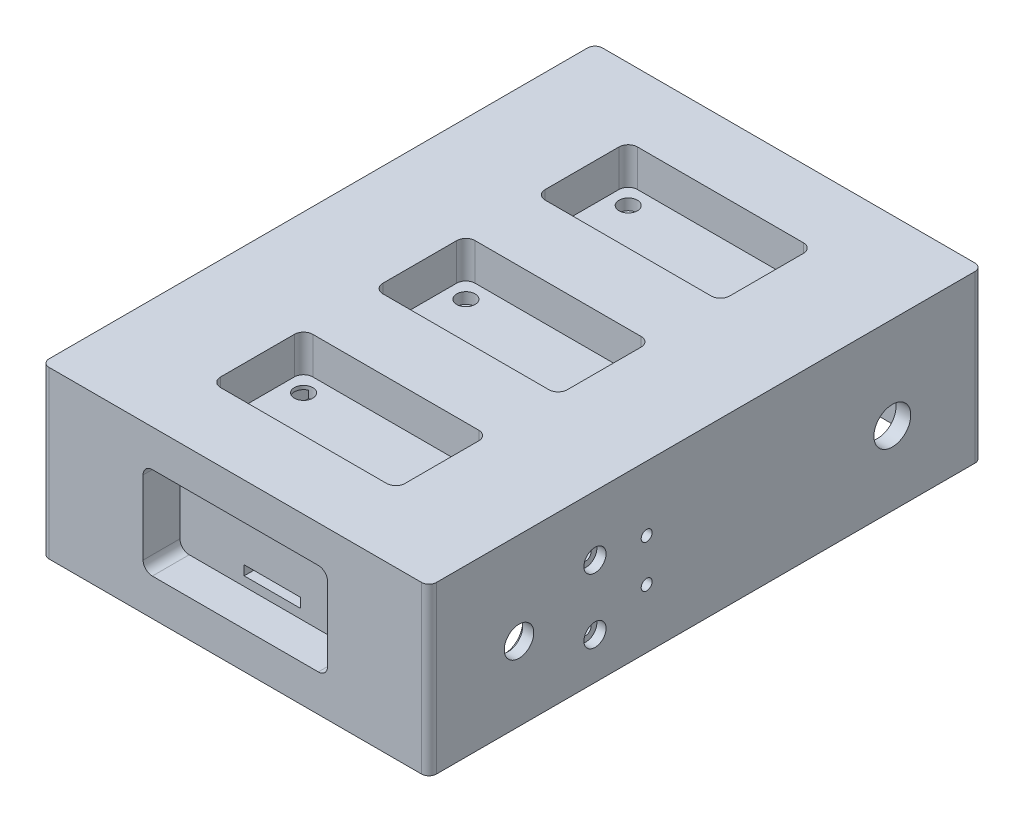
from build123d import *

# Parameters (mm, degrees)
SKETCH_1_W           = 105
SKETCH_1_H           = 150
EXTRUDE_1_DEPTH      = 45
CUT_EXTRUDE_1_DEPTH  = 10
CUT_EXTRUDE_2_DEPTH  = 10
SHELL_1_T            = -4
SKETCH_5_R           = 1.45
SKETCH_5_R_2         = 4
SKETCH_5_R_3         = 5
CUT_EXTRUDE_3_DEPTH  = 15
SKETCH_6_R           = 3
CUT_EXTRUDE_4_DEPTH  = 2.5
CUT_EXTRUDE_START    = -3
SKETCH_10_W          = 5
SKETCH_10_H          = 36.5
CUT_EXTRUDE_15_DEPTH = 100.655315425
SKETCH_11_R          = 5
CUT_EXTRUDE_16_DEPTH = 1
SKETCH_12_R          = 1.45
CUT_EXTRUDE_17_DEPTH = 14
SKETCH_13_R          = 1.45
CUT_EXTRUDE_18_DEPTH = 10
SKETCH_14_R          = 1.45
CUT_EXTRUDE_19_DEPTH = 3
SKETCH_15_R          = 2.5
SKETCH_15_W          = 15.2
SKETCH_15_H          = 2.6
CUT_EXTRUDE_20_DEPTH = 3
SKETCH_16_W          = 14
SKETCH_16_H          = 1.8
CUT_EXTRUDE_21_DEPTH = 3
SKETCH_17_R          = 2.5
SKETCH_17_W          = 15.2
SKETCH_17_H          = 2.6
CUT_EXTRUDE_22_DEPTH = 3
SKETCH_18_W          = 14
SKETCH_18_H          = 1.8
CUT_EXTRUDE_23_DEPTH = 3
SKETCH_19_R          = 2.5
SKETCH_19_W          = 15.2
SKETCH_19_H          = 2.6
CUT_EXTRUDE_24_DEPTH = 3
SKETCH_20_W          = 14
SKETCH_20_H          = 1.8
CUT_EXTRUDE_25_DEPTH = 8
SKETCH_21_W          = 9.5
SKETCH_21_H          = 14.5
CUT_EXTRUDE_26_DEPTH = 4
SKETCH_22_R          = 1.425
CUT_EXTRUDE_27_DEPTH = 9
SKETCH_24_R          = 1.475
CUT_EXTRUDE_28_DEPTH = 137.656503687
FILLET_1_R           = 2


with BuildPart() as part:
    # Эскиз1 → Бобышка-Вытянуть1 (new body)
    with BuildSketch(Plane(origin=(0, 0, 0), x_dir=(1, 0, 0), z_dir=(0, 1, 0))):
        Rectangle(SKETCH_1_W, SKETCH_1_H)
    extrude(amount=EXTRUDE_1_DEPTH)

    # Эскиз2 → Вырез-Вытянуть1 (cut)
    with BuildSketch(Plane.XY.offset(75)):
        with BuildLine():
            Line((-22.5, 10), (22.5, 10))
            ThreePointArc((22.5, 10), (24.267766953, 10.732233047), (25, 12.5))
            Line((25, 12.5), (25, 32.5))
            ThreePointArc((25, 32.5), (24.267766953, 34.267766953), (22.5, 35))
            Line((22.5, 35), (-22.5, 35))
            ThreePointArc((-22.5, 35), (-24.267766953, 34.267766953), (-25, 32.5))
            Line((-25, 32.5), (-25, 12.5))
            ThreePointArc((-25, 12.5), (-24.267766953, 10.732233047), (-22.5, 10))
        make_face()
    cut_extrude_1 = extrude(amount=-CUT_EXTRUDE_1_DEPTH, mode=Mode.SUBTRACT)

    # Эскиз4 → Вырез-Вытянуть2 (cut)
    with BuildSketch(Plane(origin=(0, 45, 0), x_dir=(1, 0, 0), z_dir=(0, 1, 0))):
        with BuildLine():
            Line((-22.5, 31.5), (22.5, 31.5))
            ThreePointArc((22.5, 31.5), (24.267766953, 32.232233047), (25, 34))
            Line((25, 34), (25, 54))
            ThreePointArc((25, 54), (24.267766953, 55.767766953), (22.5, 56.5))
            Line((22.5, 56.5), (-22.5, 56.5))
            ThreePointArc((-22.5, 56.5), (-24.267766953, 55.767766953), (-25, 54))
            Line((-25, 54), (-25, 34))
            ThreePointArc((-25, 34), (-24.267766953, 32.232233047), (-22.5, 31.5))
        make_face()
        with BuildLine():
            Line((-22.5, -12.5), (22.5, -12.5))
            ThreePointArc((22.5, -12.5), (24.267766953, -11.767766953), (25, -10))
            Line((25, -10), (25, 10))
            ThreePointArc((25, 10), (24.267766953, 11.767766953), (22.5, 12.5))
            Line((22.5, 12.5), (-22.5, 12.5))
            ThreePointArc((-22.5, 12.5), (-24.267766953, 11.767766953), (-25, 10))
            Line((-25, 10), (-25, -10))
            ThreePointArc((-25, -10), (-24.267766953, -11.767766953), (-22.5, -12.5))
        make_face()
        with BuildLine():
            Line((-22.5, -56.5), (22.5, -56.5))
            ThreePointArc((22.5, -56.5), (24.267766953, -55.767766953), (25, -54))
            Line((25, -54), (25, -34))
            ThreePointArc((25, -34), (24.267766953, -32.232233047), (22.5, -31.5))
            Line((22.5, -31.5), (-22.5, -31.5))
            ThreePointArc((-22.5, -31.5), (-24.267766953, -32.232233047), (-25, -34))
            Line((-25, -34), (-25, -54))
            ThreePointArc((-25, -54), (-24.267766953, -55.767766953), (-22.5, -56.5))
        make_face()
    extrude(amount=-CUT_EXTRUDE_2_DEPTH, mode=Mode.SUBTRACT)

    # Зеркальное отражение1: Вырез-Вытянуть1 across plane
    add(cut_extrude_1.mirror(Plane.XY), mode=Mode.SUBTRACT)

    # Оболочка1
    shell_1_openings = [part.faces().sort_by_distance(p)[0] for p in [
        (0, 0, 0),
    ]]
    offset(amount=SHELL_1_T, openings=shell_1_openings, kind=Kind.INTERSECTION)

    # Эскиз5 → Вырез-Вытянуть3 (cut)
    with BuildSketch(Plane.ZY.offset(52.5)):
        with Locations((30, 28.75)):
            Circle(SKETCH_5_R)
        with Locations((30, 11.25)):
            Circle(SKETCH_5_R)
        with Locations((50.6, 20)):
            Circle(SKETCH_5_R_2)
        with Locations((-50.6, 20)):
            Circle(SKETCH_5_R_3)
    cut_extrude_3 = extrude(amount=-CUT_EXTRUDE_3_DEPTH, mode=Mode.SUBTRACT)

    # Эскиз6 → Вырез-Вытянуть4 (cut)
    with BuildSketch(Plane.ZY.offset(52.5)):
        with Locations((30, 28.75)):
            Circle(SKETCH_6_R)
        with Locations((30, 11.25)):
            Circle(SKETCH_6_R)
    cut_extrude_4 = extrude(amount=-CUT_EXTRUDE_4_DEPTH, mode=Mode.SUBTRACT)

    # Эскиз10 → Вырез-Вытянуть15 (cut)
    with BuildSketch(Plane(origin=(0, 31, 0), x_dir=(-1, 0, 0), z_dir=(0, -1, 0)).offset(CUT_EXTRUDE_START)):
        with Locations((23.5, -45.75)):
            Rectangle(SKETCH_10_W, SKETCH_10_H)
    cut_extrude_15 = extrude(amount=CUT_EXTRUDE_15_DEPTH, mode=Mode.SUBTRACT)

    # Эскиз11 → Вырез-Вытянуть16 (cut)
    with BuildSketch(Plane(origin=(-48.5, 0, 0), x_dir=(0, 0, -1), z_dir=(1, 0, 0))):
        with Locations((-50.6, 20)):
            Circle(SKETCH_11_R)
    cut_extrude_16 = extrude(amount=-CUT_EXTRUDE_16_DEPTH, mode=Mode.SUBTRACT)

    # Зеркальное отражение2: Вырез-Вытянуть3, Вырез-Вытянуть4, Вырез-Вытянуть15, Вырез-Вытянуть16 across plane
    add(cut_extrude_3.mirror(Plane(origin=(0, 0, 0), x_dir=(0, 0, 1), z_dir=(1, 0, 0))), mode=Mode.SUBTRACT)
    add(cut_extrude_4.mirror(Plane(origin=(0, 0, 0), x_dir=(0, 0, 1), z_dir=(1, 0, 0))), mode=Mode.SUBTRACT)
    add(cut_extrude_15.mirror(Plane(origin=(0, 0, 0), x_dir=(0, 0, 1), z_dir=(1, 0, 0))), mode=Mode.SUBTRACT)
    add(cut_extrude_16.mirror(Plane(origin=(0, 0, 0), x_dir=(0, 0, 1), z_dir=(1, 0, 0))), mode=Mode.SUBTRACT)

    # Эскиз12 → Вырез-Вытянуть17 (cut)
    with BuildSketch(Plane(origin=(0, 6, 0), x_dir=(-1, 0, 0), z_dir=(0, -1, 0))):
        with Locations((-10, -63)):
            Circle(SKETCH_12_R)
        with Locations((10, -63)):
            Circle(SKETCH_12_R)
    extrude(amount=-CUT_EXTRUDE_17_DEPTH, mode=Mode.SUBTRACT)

    # Эскиз13 → Вырез-Вытянуть18 (cut)
    with BuildSketch(Plane(origin=(0, 31, 0), x_dir=(-1, 0, 0), z_dir=(0, -1, 0))):
        with Locations((-9, -29.5)):
            Circle(SKETCH_13_R)
        with Locations((9, -29.5)):
            Circle(SKETCH_13_R)
    extrude(amount=-CUT_EXTRUDE_18_DEPTH, mode=Mode.SUBTRACT)

    # Эскиз14 → Вырез-Вытянуть19 (cut)
    with BuildSketch(Plane(origin=(0, 31, 0), x_dir=(-1, 0, 0), z_dir=(0, -1, 0))):
        with Locations((20, 47.5)):
            Circle(SKETCH_14_R)
        with Locations((20, -7.5)):
            Circle(SKETCH_14_R)
        with Locations((-20, -7.5)):
            Circle(SKETCH_14_R)
        with Locations((-20, 47.5)):
            Circle(SKETCH_14_R)
    extrude(amount=-CUT_EXTRUDE_19_DEPTH, mode=Mode.SUBTRACT)

    # Эскиз15 → Вырез-Вытянуть20 (cut)
    with BuildSketch(Plane(origin=(0, 35, 0), x_dir=(1, 0, 0), z_dir=(0, 1, 0))):
        with Locations((-20, -36.5)):
            Circle(SKETCH_15_R)
        with Locations((20, -36.5)):
            Circle(SKETCH_15_R)
        with Locations((-20, 7.5)):
            Circle(SKETCH_15_R)
        with Locations((20, 7.5)):
            Circle(SKETCH_15_R)
        with Locations((-20, 51.5)):
            Circle(SKETCH_15_R)
        with Locations((20, 51.5)):
            Circle(SKETCH_15_R)
        with Locations((0, -54)):
            Rectangle(SKETCH_15_W, SKETCH_15_H)
        with Locations((0, -8.7)):
            Rectangle(SKETCH_15_W, SKETCH_15_H)
        with Locations((0, 36.6)):
            Rectangle(SKETCH_15_W, SKETCH_15_H)
    extrude(amount=-CUT_EXTRUDE_20_DEPTH, mode=Mode.SUBTRACT)

    # Эскиз16 → Вырез-Вытянуть21 (cut)
    with BuildSketch(Plane(origin=(0, 32, 0), x_dir=(1, 0, 0), z_dir=(0, 1, 0))):
        with Locations((0, -54)):
            Rectangle(SKETCH_16_W, SKETCH_16_H)
        with Locations((0, -8.7)):
            Rectangle(SKETCH_16_W, SKETCH_16_H)
        with Locations((0, 36.6)):
            Rectangle(SKETCH_16_W, SKETCH_16_H)
    extrude(amount=-CUT_EXTRUDE_21_DEPTH, mode=Mode.SUBTRACT)

    # Эскиз17 → Вырез-Вытянуть22 (cut)
    with BuildSketch(Plane.XY.offset(65)):
        with Locations((-20, 30)):
            Circle(SKETCH_17_R)
        with Locations((20, 30)):
            Circle(SKETCH_17_R)
        with Locations((0, 13.8)):
            Rectangle(SKETCH_17_W, SKETCH_17_H)
    extrude(amount=-CUT_EXTRUDE_22_DEPTH, mode=Mode.SUBTRACT)

    # Эскиз18 → Вырез-Вытянуть23 (cut)
    with BuildSketch(Plane.XY.offset(62)):
        with Locations((0, 13.8)):
            Rectangle(SKETCH_18_W, SKETCH_18_H)
    extrude(amount=-CUT_EXTRUDE_23_DEPTH, mode=Mode.SUBTRACT)

    # Эскиз19 → Вырез-Вытянуть24 (cut)
    with BuildSketch(Plane(origin=(0, 0, -65), x_dir=(1, 0, 0), z_dir=(0, 0, -1))):
        with Locations((-20, -15)):
            Circle(SKETCH_19_R)
        with Locations((20, -15)):
            Circle(SKETCH_19_R)
        with Locations((0, -31.2)):
            Rectangle(SKETCH_19_W, SKETCH_19_H)
    extrude(amount=-CUT_EXTRUDE_24_DEPTH, mode=Mode.SUBTRACT)

    # Эскиз20 → Вырез-Вытянуть25 (cut)
    with BuildSketch(Plane(origin=(0, 0, -62), x_dir=(1, 0, 0), z_dir=(0, 0, -1))):
        with Locations((0, -31.2)):
            Rectangle(SKETCH_20_W, SKETCH_20_H)
    extrude(amount=-CUT_EXTRUDE_25_DEPTH, mode=Mode.SUBTRACT)

    # Эскиз21 → Вырез-Вытянуть26 (cut)
    with BuildSketch(Plane(origin=(0, 0, -75), x_dir=(1, 0, 0), z_dir=(0, 0, -1))):
        with Locations((42.5, -22.5)):
            Rectangle(SKETCH_21_W, SKETCH_21_H)
    extrude(amount=-CUT_EXTRUDE_26_DEPTH, mode=Mode.SUBTRACT)

    # Эскиз22 → Вырез-Вытянуть27 (cut)
    with BuildSketch(Plane(origin=(0, 0, 0), x_dir=(-1, 0, 0), z_dir=(0, -1, 0))):
        with Locations((-50.5, -73)):
            Circle(SKETCH_22_R)
        with Locations((-50.5, 73)):
            Circle(SKETCH_22_R)
        with Locations((50.5, 73)):
            Circle(SKETCH_22_R)
        with Locations((50.5, -73)):
            Circle(SKETCH_22_R)
        with Locations((0, 73)):
            Circle(SKETCH_22_R)
        with Locations((0, -73)):
            Circle(SKETCH_22_R)
        with Locations((-50.5, 0)):
            Circle(SKETCH_22_R)
        with Locations((50.5, 0)):
            Circle(SKETCH_22_R)
    extrude(amount=-CUT_EXTRUDE_27_DEPTH, mode=Mode.SUBTRACT)

    # Эскиз24 → Вырез-Вытянуть28 (cut, through all)
    with BuildSketch(Plane.ZY.offset(52.5)):
        with Locations((16, 16)):
            Circle(SKETCH_24_R)
        with Locations((16, 27.5)):
            Circle(SKETCH_24_R)
    extrude(amount=-CUT_EXTRUDE_28_DEPTH, mode=Mode.SUBTRACT)

    # Скругление1
    fillet_1_edges = [part.edges().sort_by_distance(p)[0] for p in [
        (52.5, 22.5, -75),
        (-52.5, 22.5, -75),
        (52.5, 22.5, 75),
        (-52.5, 22.5, 75),
    ]]
    fillet(fillet_1_edges, radius=FILLET_1_R)


solid = part.part
